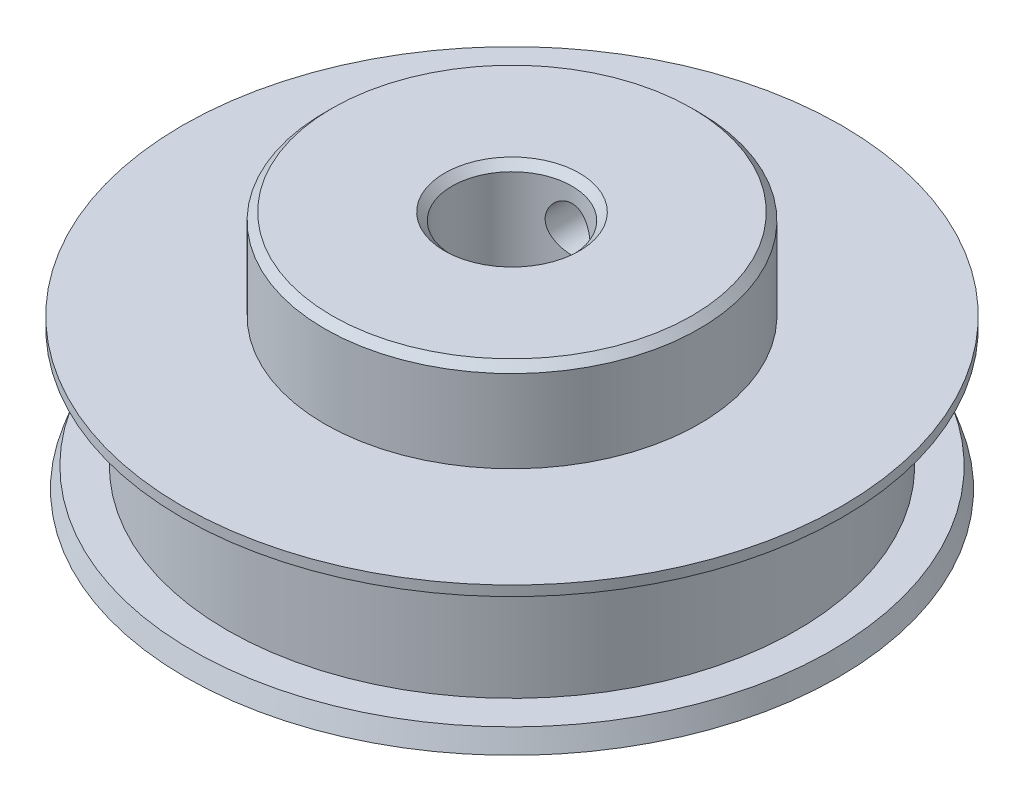
from build123d import *

# Parameters (mm, degrees)
SKETCH1_R               = 22
BOSS_EXTRUDE1_DEPTH     = 10
SKETCH2_R               = 12.5
BOSS_EXTRUDE2_DEPTH     = 6
CUT_EXTRUDE1_REACH      = 36.986
CUT_EXTRUDE1_END_RADIUS = 12.5
SKETCH3_R               = 1.5
CUT_EXTRUDE2_REACH      = 36.986
SKETCH4_R               = 4
CUT_EXTRUDE3_START      = -1.33
SKETCH5_R               = 22
SKETCH5_R_2             = 19
CUT_EXTRUDE3_DEPTH      = 7.33333
CHAMFER1_SIZE           = 2
CHAMFER1_SIZE_2         = 0.666
CHAMFER2_SIZE           = 0.5


with BuildPart() as part:
    # Sketch1 → Boss-Extrude1 (new body)
    with BuildSketch(Plane(origin=(0, 0, 0), x_dir=(1, 0, 0), z_dir=(0, 1, 0))):
        with Locations(Location((0, 0, 0), (0, 0, 270))):
            Circle(SKETCH1_R)
    extrude(amount=BOSS_EXTRUDE1_DEPTH)

    # Sketch2 → Boss-Extrude2 (add)
    with BuildSketch(Plane(origin=(0, 10, 0), x_dir=(1, 0, 0), z_dir=(0, 1, 0))):
        with Locations(Location((0, 0, 0), (0, 0, 270))):
            Circle(SKETCH2_R)
    extrude(amount=BOSS_EXTRUDE2_DEPTH)

    # Cut-Extrude1: up to this cylinder (the profile starts inside it)
    cut_extrude1_end = Plane(origin=(0, 13, 0), z_dir=(0, -1, 0)) * Cylinder(CUT_EXTRUDE1_END_RADIUS, 99.972, mode=Mode.PRIVATE)
    # Sketch3 → Cut-Extrude1 (cut, up to the surface)
    with BuildSketch(Plane.XY, mode=Mode.PRIVATE) as cut_extrude1_sk1:
        with Locations((0, 13)):
            Circle(SKETCH3_R)
    cut_extrude1_tool1 = extrude(cut_extrude1_sk1.sketch, amount=-CUT_EXTRUDE1_REACH, mode=Mode.PRIVATE) & cut_extrude1_end
    add(cut_extrude1_tool1.solids().sort_by_distance((0, 13, 0))[0], mode=Mode.SUBTRACT)

    # Sketch4 → Cut-Extrude2 (cut, up to next)
    with BuildSketch(Plane(origin=(0, 16, 0), x_dir=(1, 0, 0), z_dir=(0, 1, 0)), mode=Mode.PRIVATE) as cut_extrude2_sk1:
        with Locations(Location((0, 0, 0), (0, 0, 270))):
            Circle(SKETCH4_R)
    cut_extrude2_tool1 = extrude(cut_extrude2_sk1.sketch, amount=-CUT_EXTRUDE2_REACH, mode=Mode.PRIVATE) & part.part
    add(cut_extrude2_tool1.solids().sort_by_distance((0, 16, 0))[0], mode=Mode.SUBTRACT)

    # Sketch5 → Cut-Extrude3 (cut)
    with BuildSketch(Plane.XZ.offset(CUT_EXTRUDE3_START)):
        with Locations(Location((0, 0, 0), (0, 0, 270))):
            Circle(SKETCH5_R)
        with Locations(Location((0, 0, 0), (0, 0, 270))):
            Circle(SKETCH5_R_2, mode=Mode.SUBTRACT)
    extrude(amount=-CUT_EXTRUDE3_DEPTH, mode=Mode.SUBTRACT)

    # Chamfer1
    # the kernel refuses this chamfer: 2, 0.666 mm, written as the material it takes off along each edge
    with BuildSketch(Plane(origin=(0, 1.33, 0), x_dir=(0, 0, 1), z_dir=(1, 0, 0))) as chamfer1_piece_1:
        Polygon((22, CHAMFER1_SIZE), (22 - CHAMFER1_SIZE_2, 0), (22, 0), align=None)
    revolve(axis=Axis((0, 1.33, 0), (0, -1, 0)), mode=Mode.SUBTRACT)
    with BuildSketch(Plane(origin=(0, 8.66333, 0), x_dir=(0, 0, 1), z_dir=(1, 0, 0))) as chamfer1_piece_2:
        Polygon((22 - CHAMFER1_SIZE, 0), (22, -CHAMFER1_SIZE_2), (22, 0), align=None)
    revolve(axis=Axis((0, 8.66333, 0), (0, -1, 0)), mode=Mode.SUBTRACT)

    # Chamfer2
    chamfer2_edges = [part.edges().sort_by_distance(p)[0] for p in [
        (0, 16, -4),
        (0, 0, -4),
        (0, 16, -12.5),
    ]]
    chamfer(chamfer2_edges, length=CHAMFER2_SIZE)


solid = part.part
